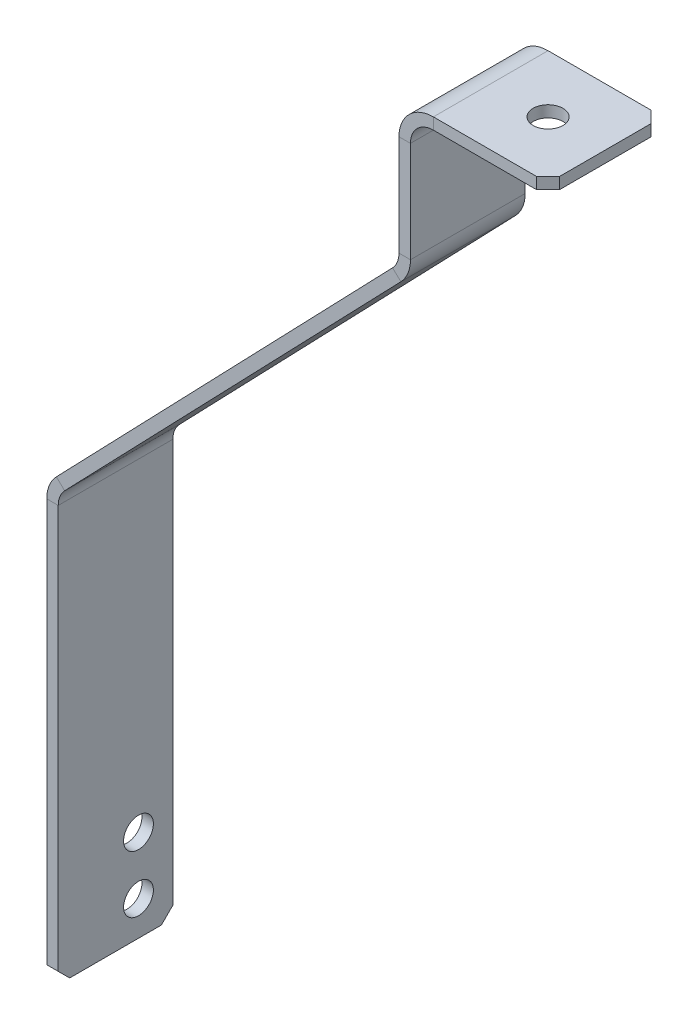
from build123d import *

# Parameters (mm, degrees)
SM_BASE_FLANGE_1_DEPTH = 50
SKETCH_6_R             = 6.5
CUT_EXTRUDE_1_DEPTH    = 10
SKETCH_7_R             = 6.5
CUT_EXTRUDE_2_DEPTH    = 10
OTHER_START            = 147.502474556
OTHER_1_OUTLINE_W      = 10
OTHER_1_OUTLINE_H      = 8
OTHER_1_DEPTH          = 3.535533905
OTHER_START_2          = 182.857813615
OTHER_1_2_OUTLINE_W    = 38
OTHER_1_2_OUTLINE_H    = 8
OTHER_1_2_DEPTH        = 3.535533906
OTHER_1_3_OUTLINE_W    = 7
OTHER_1_3_OUTLINE_H    = 10
OTHER_1_3_DEPTH        = 3.535533906
OTHER_START_3          = -35.355339059
OTHER_1_4_OUTLINE_W    = 7
OTHER_1_4_OUTLINE_H    = 38
OTHER_1_4_DEPTH        = 3.535533906


# Read off the part's stored shape, not the designer's step: Затупленный угол1
# Sheet-metal steps are written as plain solids
with BuildPart() as part:
    # Sketch 1 → Базовая кромка1 (new body)
    with BuildSketch(Plane.XY):
        with BuildLine():
            Line((213.6, 404.5), (163.6, 404.5))
            ThreePointArc((163.6, 404.5), (156.528932188, 401.571067812), (153.6, 394.5))
            Line((153.6, 394.5), (153.6, 350.548284888))
            ThreePointArc((153.6, 350.548284888), (152.511654958, 344.938841391), (149.404552488, 340.143399231))
            Line((149.404552488, 340.143399231), (2.796965008, 187.904400513))
            ThreePointArc((2.796965008, 187.904400513), (0.725563362, 184.707439072), (0, 180.967810075))
            Line((0, 180.967810075), (0, 0))
            Line((0, 0), (-5, 0))
            Line((-5, 0), (-5, 180.967810075))
            ThreePointArc((-5, 180.967810075), (-3.911654958, 186.577253571), (-0.804552488, 191.372695731))
            Line((-0.804552488, 191.372695731), (145.803034992, 343.61169445))
            ThreePointArc((145.803034992, 343.61169445), (147.874436638, 346.80865589), (148.6, 350.548284888))
            Line((148.6, 350.548284888), (148.6, 394.5))
            ThreePointArc((148.6, 394.5), (152.993398282, 405.106601718), (163.6, 409.5))
            Line((163.6, 409.5), (213.6, 409.5))
            Line((213.6, 409.5), (213.6, 404.5))
        make_face()
    extrude(amount=SM_BASE_FLANGE_1_DEPTH)

    # Эскиз6 → Вырез-Вытянуть1 (cut)
    with BuildSketch(Plane.ZY.offset(5)):
        with Locations(Location((15, 15, 0), (0, 0, 270))):
            Circle(SKETCH_6_R)
        with Locations(Location((15, 40, 0), (0, 0, 270))):
            Circle(SKETCH_6_R)
    extrude(amount=-CUT_EXTRUDE_1_DEPTH, mode=Mode.SUBTRACT)

    # Эскиз7 → Вырез-Вытянуть2 (cut)
    with BuildSketch(Plane(origin=(0, 409.5, 0), x_dir=(1, 0, 0), z_dir=(0, 1, 0))):
        with Locations(Location((188.6, -25, 0), (0, 0, 180))):
            Circle(SKETCH_7_R)
    extrude(amount=-CUT_EXTRUDE_2_DEPTH, mode=Mode.SUBTRACT)

    # Other 1 outline → Other 1 (cut)
    with BuildSketch(Plane(origin=(0, 0, 0), x_dir=(0.707106781186548, 0, 0.707106781186547), z_dir=(0.707106781186547, 0, -0.707106781186548)).offset(OTHER_START)):
        with Locations((151, -407)):
            Rectangle(OTHER_1_OUTLINE_W, OTHER_1_OUTLINE_H)
    extrude(amount=OTHER_1_DEPTH, mode=Mode.SUBTRACT)

    # Other 1 2 outline → Other 1 2 (cut)
    with BuildSketch(Plane(origin=(0, 0, 0), x_dir=(0.707106781186548, 0, -0.707106781186547), z_dir=(0.707106781186547, 0, 0.707106781186548)).offset(OTHER_START_2)):
        with Locations((130, 407)):
            Rectangle(OTHER_1_2_OUTLINE_W, OTHER_1_2_OUTLINE_H)
    extrude(amount=OTHER_1_2_DEPTH, mode=Mode.SUBTRACT)

    # Other 1 3 outline → Other 1 3 (cut)
    with BuildSketch(Plane(origin=(0, 0, 0), x_dir=(1, 0, 0), z_dir=(0, 0.707106781186547, 0.707106781186548))):
        with Locations((-2.5, 0)):
            Rectangle(OTHER_1_3_OUTLINE_W, OTHER_1_3_OUTLINE_H)
    extrude(amount=OTHER_1_3_DEPTH, mode=Mode.SUBTRACT)

    # Other 1 4 outline → Other 1 4 (cut)
    with BuildSketch(Plane(origin=(0, 0, 0), x_dir=(1, 0, 0), z_dir=(0, 0.707106781186547, -0.707106781186548)).offset(OTHER_START_3)):
        with Locations((-2.5, -21)):
            Rectangle(OTHER_1_4_OUTLINE_W, OTHER_1_4_OUTLINE_H)
    extrude(amount=OTHER_1_4_DEPTH, mode=Mode.SUBTRACT)


solid = part.part
